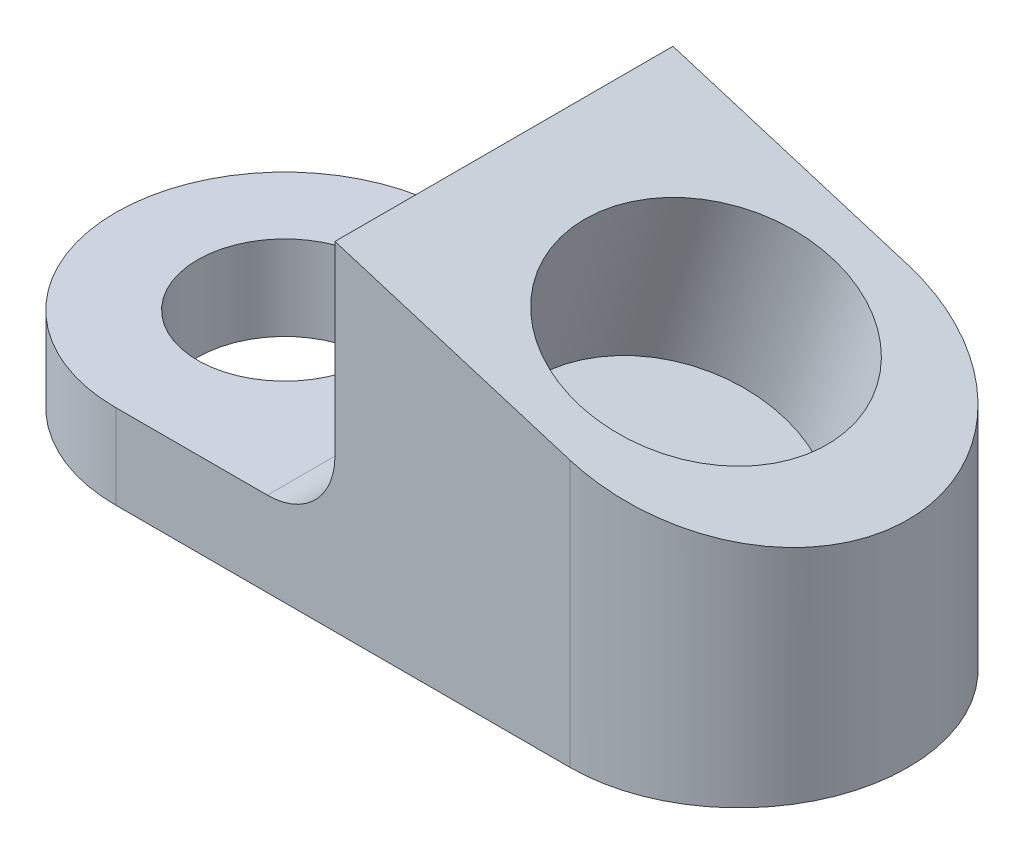
from build123d import *

# Parameters (mm, degrees)
BOSS_EXTRUDE1_DEPTH = 12.7
SKETCH2_R           = 9.525
CUT_EXTRUDE1_DEPTH  = 12.7
SKETCH3_R           = 6.5484375
CUT_EXTRUDE2_DEPTH  = 68.319185137
FILLET3_START       = -1
FILLET3_DEPTH       = 26.4
CUT_EXTRUDE3_DEPTH  = 68.319185137
FILLET4_R           = 5.08


with BuildPart() as part:
    # Sketch1 → Boss-Extrude1 (new, symmetric)
    with BuildSketch(Plane.XY):
        Polygon((0, 0), (63.3062413, 0), (63.3062413, 16.117198375), (32.943565298, 25.4), (32.943565298, 6.35), (0, 6.35), align=None)
    extrude(amount=BOSS_EXTRUDE1_DEPTH, both=True)

    # Sketch2 → Cut-Extrude1 (cut)
    with BuildSketch(Plane(origin=(9.91780582, 32.439681136, 0), x_dir=(0.9563047559630374, -0.29237170472273033, 0), z_dir=(0.29237170472273033, 0.9563047559630374, 0))):
        with Locations(Location((39.952846873, 0, 0), (0, 0, 180))):
            Circle(SKETCH2_R)
    extrude(amount=-CUT_EXTRUDE1_DEPTH, mode=Mode.SUBTRACT)

    # Sketch3 → Cut-Extrude2 (cut, through all)
    with BuildSketch(Plane(origin=(0, 6.35, 0), x_dir=(1, 0, 0), z_dir=(0, 1, 0))):
        with Locations(Location((16.471782649, 0, 0), (0, 0, 180))):
            Circle(SKETCH3_R)
    extrude(amount=-CUT_EXTRUDE2_DEPTH, mode=Mode.SUBTRACT)

    # Fillet3: read off the stored shape, not the designer's step
    # Fillet3 outline → Fillet3 (cut)
    with BuildSketch(Plane(origin=(0, 0, 0), x_dir=(1, 0, 0), z_dir=(0, 1, 0)).offset(FILLET3_START)):
        with BuildLine():
            ThreePointArc((50.6062413, 12.7), (59.586497421, 8.980256121), (63.3062413, 0))
            Line((63.3062413, 0), (63.3062413, 12.7))
            Line((63.3062413, 12.7), (50.6062413, 12.7))
        make_face()
        with BuildLine():
            ThreePointArc((63.3062413, 0), (59.586497421, -8.980256121), (50.6062413, -12.7))
            Line((50.6062413, -12.7), (63.3062413, -12.7))
            Line((63.3062413, -12.7), (63.3062413, 0))
        make_face()
    extrude(amount=FILLET3_DEPTH, mode=Mode.SUBTRACT)

    # Sketch4 → Cut-Extrude3 (cut, through all)
    with BuildSketch(Plane(origin=(0, 6.35, 0), x_dir=(1, 0, 0), z_dir=(0, 1, 0))):
        with BuildLine():
            Line((16.471782649, 12.7), (0, 12.7))
            Line((0, 12.7), (0, -12.7))
            Line((0, -12.7), (16.471782649, -12.7))
            ThreePointArc((16.471782649, -12.7), (3.771782649, 0), (16.471782649, 12.7))
        make_face()
    extrude(amount=-CUT_EXTRUDE3_DEPTH, mode=Mode.SUBTRACT)

    # Fillet4
    fillet4_edges = [part.edges().sort_by_distance(p)[0] for p in [
        (32.943565298, 6.35, 0),
    ]]
    fillet(fillet4_edges, radius=FILLET4_R)


solid = part.part
